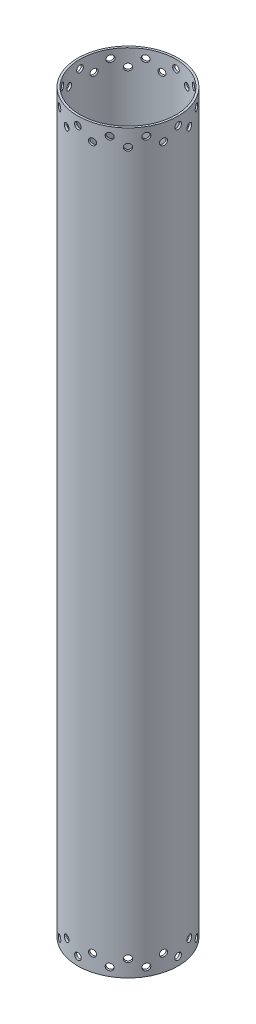
from build123d import *

# Parameters (mm, degrees)
SKETCH2_R                = 76.2
SKETCH2_R_2              = 73.025
BOSS_EXTRUDE1_DEPTH      = 1117.6
SKETCH3_R                = 5.0419
CUT_EXTRUDE1_DEPTH       = 1143
SKETCH6_R                = 5.0419
CUT_EXTRUDE2_DEPTH       = 25.4
CIRPATTERN2_COUNT        = 12
MIRROR1_COPY_1_SKETCH_R  = 5.0419
MIRROR1_COPY_1_DEPTH     = 1143
MIRROR1_COPY_2_SKETCH_R  = 5.0419
MIRROR1_COPY_2_DEPTH     = 1143
MIRROR1_COPY_3_SKETCH_R  = 5.0419
MIRROR1_COPY_3_DEPTH     = 1143
MIRROR1_COPY_4_SKETCH_R  = 5.0419
MIRROR1_COPY_4_DEPTH     = 1143
MIRROR1_COPY_5_SKETCH_R  = 5.0419
MIRROR1_COPY_5_DEPTH     = 1143
MIRROR1_COPY_6_SKETCH_R  = 5.0419
MIRROR1_COPY_6_DEPTH     = 1143
MIRROR1_COPY_7_SKETCH_R  = 5.0419
MIRROR1_COPY_7_DEPTH     = 1143
MIRROR1_COPY_8_SKETCH_R  = 5.0419
MIRROR1_COPY_8_DEPTH     = 1143
MIRROR1_COPY_9_SKETCH_R  = 5.0419
MIRROR1_COPY_9_DEPTH     = 1143
MIRROR1_COPY_10_SKETCH_R = 5.0419
MIRROR1_COPY_10_DEPTH    = 1143
MIRROR1_COPY_11_SKETCH_R = 5.0419
MIRROR1_COPY_11_DEPTH    = 1143
MIRROR1_COPY_12_SKETCH_R = 5.0419
MIRROR1_COPY_12_DEPTH    = 25.4
MIRROR1_COPY_13_SKETCH_R = 5.0419
MIRROR1_COPY_13_DEPTH    = 25.4
MIRROR1_COPY_14_SKETCH_R = 5.0419
MIRROR1_COPY_14_DEPTH    = 25.4
MIRROR1_COPY_15_SKETCH_R = 5.0419
MIRROR1_COPY_15_DEPTH    = 25.4
MIRROR1_COPY_16_SKETCH_R = 5.0419
MIRROR1_COPY_16_DEPTH    = 25.4
MIRROR1_COPY_17_SKETCH_R = 5.0419
MIRROR1_COPY_17_DEPTH    = 25.4
MIRROR1_COPY_18_SKETCH_R = 5.0419
MIRROR1_COPY_18_DEPTH    = 25.4
MIRROR1_COPY_19_SKETCH_R = 5.0419
MIRROR1_COPY_19_DEPTH    = 25.4
MIRROR1_COPY_20_SKETCH_R = 5.0419
MIRROR1_COPY_20_DEPTH    = 25.4
MIRROR1_COPY_21_SKETCH_R = 5.0419
MIRROR1_COPY_21_DEPTH    = 25.4
MIRROR1_COPY_22_SKETCH_R = 5.0419
MIRROR1_COPY_22_DEPTH    = 25.4
MIRROR1_COPY_23_SKETCH_R = 5.0419
MIRROR1_COPY_23_DEPTH    = 1143
MIRROR1_COPY_24_SKETCH_R = 5.0419
MIRROR1_COPY_24_DEPTH    = 25.4


with BuildPart() as part:
    # Sketch2 → Boss-Extrude1 (new body)
    with BuildSketch(Plane(origin=(0, 0, 0), x_dir=(1, 0, 0), z_dir=(0, 1, 0))):
        Circle(SKETCH2_R)
        Circle(SKETCH2_R_2, mode=Mode.SUBTRACT)
    extrude(amount=BOSS_EXTRUDE1_DEPTH)

    # Sketch3 → Cut-Extrude1 (cut)
    with BuildSketch(Plane.XY):
        with Locations((0, 1104.9)):
            Circle(SKETCH3_R)
    cut_extrude1 = extrude(amount=-CUT_EXTRUDE1_DEPTH, mode=Mode.SUBTRACT)

    # Sketch6 → Cut-Extrude2 (cut)
    with BuildSketch(Plane(origin=(-19.722011237, 0, 73.603547963), x_dir=(0, -1, 0), z_dir=(-0.25881904510252135, 0, 0.9659258262890681))):
        with Locations((-1092.2, 0)):
            Circle(SKETCH6_R)
    cut_extrude2 = extrude(amount=-CUT_EXTRUDE2_DEPTH, mode=Mode.SUBTRACT)

    # CirPattern2: Cut-Extrude1, Cut-Extrude2 ×12 about axis
    cirpattern2_axis = Axis((0, 1117.6, 0), (0, -1, 0))
    add([cut_extrude1.rotate(cirpattern2_axis, i * 360 / CIRPATTERN2_COUNT) for i in range(1, CIRPATTERN2_COUNT)], mode=Mode.SUBTRACT)
    add([cut_extrude2.rotate(cirpattern2_axis, i * 360 / CIRPATTERN2_COUNT) for i in range(1, CIRPATTERN2_COUNT)], mode=Mode.SUBTRACT)

    # Mirror1 copy 1 sketch → Mirror1 copy 1 (cut)
    with BuildSketch(Plane(origin=(0, 1117.6, 0), x_dir=(0.8660254037844387, 0, 0.49999999999999994), z_dir=(-0.49999999999999994, 0, 0.8660254037844387))):
        with Locations((0, -1104.9)):
            Circle(MIRROR1_COPY_1_SKETCH_R)
    extrude(amount=-MIRROR1_COPY_1_DEPTH, mode=Mode.SUBTRACT)

    # Mirror1 copy 2 sketch → Mirror1 copy 2 (cut)
    with BuildSketch(Plane(origin=(0, 1117.6, 0), x_dir=(0.5000000000000001, 0, 0.8660254037844386), z_dir=(-0.8660254037844386, 0, 0.5000000000000001))):
        with Locations((0, -1104.9)):
            Circle(MIRROR1_COPY_2_SKETCH_R)
    extrude(amount=-MIRROR1_COPY_2_DEPTH, mode=Mode.SUBTRACT)

    # Mirror1 copy 3 sketch → Mirror1 copy 3 (cut)
    with BuildSketch(Plane(origin=(0, 1117.6, 0), x_dir=(0, 0, 1), z_dir=(-1, 0, 0))):
        with Locations((0, -1104.9)):
            Circle(MIRROR1_COPY_3_SKETCH_R)
    extrude(amount=-MIRROR1_COPY_3_DEPTH, mode=Mode.SUBTRACT)

    # Mirror1 copy 4 sketch → Mirror1 copy 4 (cut)
    with BuildSketch(Plane(origin=(0, 1117.6, 0), x_dir=(-0.4999999999999998, 0, 0.8660254037844387), z_dir=(-0.8660254037844387, 0, -0.4999999999999998))):
        with Locations((0, -1104.9)):
            Circle(MIRROR1_COPY_4_SKETCH_R)
    extrude(amount=-MIRROR1_COPY_4_DEPTH, mode=Mode.SUBTRACT)

    # Mirror1 copy 5 sketch → Mirror1 copy 5 (cut)
    with BuildSketch(Plane(origin=(0, 1117.6, 0), x_dir=(-0.8660254037844387, 0, 0.49999999999999994), z_dir=(-0.49999999999999994, 0, -0.8660254037844387))):
        with Locations((0, -1104.9)):
            Circle(MIRROR1_COPY_5_SKETCH_R)
    extrude(amount=-MIRROR1_COPY_5_DEPTH, mode=Mode.SUBTRACT)

    # Mirror1 copy 6 sketch → Mirror1 copy 6 (cut)
    with BuildSketch(Plane(origin=(0, 1117.6, 0), x_dir=(-1, 0, 0), z_dir=(0, 0, -1))):
        with Locations((0, -1104.9)):
            Circle(MIRROR1_COPY_6_SKETCH_R)
    extrude(amount=-MIRROR1_COPY_6_DEPTH, mode=Mode.SUBTRACT)

    # Mirror1 copy 7 sketch → Mirror1 copy 7 (cut)
    with BuildSketch(Plane(origin=(0, 1117.6, 0), x_dir=(-0.8660254037844386, 0, -0.5000000000000001), z_dir=(0.5000000000000001, 0, -0.8660254037844386))):
        with Locations((0, -1104.9)):
            Circle(MIRROR1_COPY_7_SKETCH_R)
    extrude(amount=-MIRROR1_COPY_7_DEPTH, mode=Mode.SUBTRACT)

    # Mirror1 copy 8 sketch → Mirror1 copy 8 (cut)
    with BuildSketch(Plane(origin=(0, 1117.6, 0), x_dir=(-0.5000000000000004, 0, -0.8660254037844384), z_dir=(0.8660254037844384, 0, -0.5000000000000004))):
        with Locations((0, -1104.9)):
            Circle(MIRROR1_COPY_8_SKETCH_R)
    extrude(amount=-MIRROR1_COPY_8_DEPTH, mode=Mode.SUBTRACT)

    # Mirror1 copy 9 sketch → Mirror1 copy 9 (cut)
    with BuildSketch(Plane(origin=(0, 1117.6, 0), x_dir=(0, 0, -1), z_dir=(1, 0, 0))):
        with Locations((0, -1104.9)):
            Circle(MIRROR1_COPY_9_SKETCH_R)
    extrude(amount=-MIRROR1_COPY_9_DEPTH, mode=Mode.SUBTRACT)

    # Mirror1 copy 10 sketch → Mirror1 copy 10 (cut)
    with BuildSketch(Plane(origin=(0, 1117.6, 0), x_dir=(0.5000000000000001, 0, -0.8660254037844386), z_dir=(0.8660254037844386, 0, 0.5000000000000001))):
        with Locations((0, -1104.9)):
            Circle(MIRROR1_COPY_10_SKETCH_R)
    extrude(amount=-MIRROR1_COPY_10_DEPTH, mode=Mode.SUBTRACT)

    # Mirror1 copy 11 sketch → Mirror1 copy 11 (cut)
    with BuildSketch(Plane(origin=(0, 1117.6, 0), x_dir=(0.8660254037844384, 0, -0.5000000000000004), z_dir=(0.5000000000000004, 0, 0.8660254037844384))):
        with Locations((0, -1104.9)):
            Circle(MIRROR1_COPY_11_SKETCH_R)
    extrude(amount=-MIRROR1_COPY_11_DEPTH, mode=Mode.SUBTRACT)

    # Mirror1 copy 12 sketch → Mirror1 copy 12 (cut)
    with BuildSketch(Plane(origin=(-53.881536726, 1117.6, 53.881536726), x_dir=(0, 1, 0), z_dir=(-0.7071067811865479, 0, 0.7071067811865472))):
        with Locations((-1092.2, 0)):
            Circle(MIRROR1_COPY_12_SKETCH_R)
    extrude(amount=-MIRROR1_COPY_12_DEPTH, mode=Mode.SUBTRACT)

    # Mirror1 copy 13 sketch → Mirror1 copy 13 (cut)
    with BuildSketch(Plane(origin=(-73.603547963, 1117.6, 19.722011237), x_dir=(0, 1, 0), z_dir=(-0.9659258262890684, 0, 0.2588190451025203))):
        with Locations((-1092.2, 0)):
            Circle(MIRROR1_COPY_13_SKETCH_R)
    extrude(amount=-MIRROR1_COPY_13_DEPTH, mode=Mode.SUBTRACT)

    # Mirror1 copy 14 sketch → Mirror1 copy 14 (cut)
    with BuildSketch(Plane(origin=(-73.603547963, 1117.6, -19.722011237), x_dir=(0, 1, 0), z_dir=(-0.9659258262890681, 0, -0.2588190451025213))):
        with Locations((-1092.2, 0)):
            Circle(MIRROR1_COPY_14_SKETCH_R)
    extrude(amount=-MIRROR1_COPY_14_DEPTH, mode=Mode.SUBTRACT)

    # Mirror1 copy 15 sketch → Mirror1 copy 15 (cut)
    with BuildSketch(Plane(origin=(-53.881536726, 1117.6, -53.881536726), x_dir=(0, 1, 0), z_dir=(-0.7071067811865472, 0, -0.7071067811865477))):
        with Locations((-1092.2, 0)):
            Circle(MIRROR1_COPY_15_SKETCH_R)
    extrude(amount=-MIRROR1_COPY_15_DEPTH, mode=Mode.SUBTRACT)

    # Mirror1 copy 16 sketch → Mirror1 copy 16 (cut)
    with BuildSketch(Plane(origin=(-19.722011237, 1117.6, -73.603547963), x_dir=(0, 1, 0), z_dir=(-0.2588190451025201, 0, -0.9659258262890684))):
        with Locations((-1092.2, 0)):
            Circle(MIRROR1_COPY_16_SKETCH_R)
    extrude(amount=-MIRROR1_COPY_16_DEPTH, mode=Mode.SUBTRACT)

    # Mirror1 copy 17 sketch → Mirror1 copy 17 (cut)
    with BuildSketch(Plane(origin=(19.722011237, 1117.6, -73.603547963), x_dir=(0, 1, 0), z_dir=(0.25881904510252124, 0, -0.9659258262890681))):
        with Locations((-1092.2, 0)):
            Circle(MIRROR1_COPY_17_SKETCH_R)
    extrude(amount=-MIRROR1_COPY_17_DEPTH, mode=Mode.SUBTRACT)

    # Mirror1 copy 18 sketch → Mirror1 copy 18 (cut)
    with BuildSketch(Plane(origin=(53.881536726, 1117.6, -53.881536726), x_dir=(0, 1, 0), z_dir=(0.707106781186548, 0, -0.707106781186547))):
        with Locations((-1092.2, 0)):
            Circle(MIRROR1_COPY_18_SKETCH_R)
    extrude(amount=-MIRROR1_COPY_18_DEPTH, mode=Mode.SUBTRACT)

    # Mirror1 copy 19 sketch → Mirror1 copy 19 (cut)
    with BuildSketch(Plane(origin=(73.603547963, 1117.6, -19.722011237), x_dir=(0, 1, 0), z_dir=(0.9659258262890683, 0, -0.25881904510252063))):
        with Locations((-1092.2, 0)):
            Circle(MIRROR1_COPY_19_SKETCH_R)
    extrude(amount=-MIRROR1_COPY_19_DEPTH, mode=Mode.SUBTRACT)

    # Mirror1 copy 20 sketch → Mirror1 copy 20 (cut)
    with BuildSketch(Plane(origin=(73.603547963, 1117.6, 19.722011237), x_dir=(0, 1, 0), z_dir=(0.9659258262890681, 0, 0.2588190451025212))):
        with Locations((-1092.2, 0)):
            Circle(MIRROR1_COPY_20_SKETCH_R)
    extrude(amount=-MIRROR1_COPY_20_DEPTH, mode=Mode.SUBTRACT)

    # Mirror1 copy 21 sketch → Mirror1 copy 21 (cut)
    with BuildSketch(Plane(origin=(53.881536726, 1117.6, 53.881536726), x_dir=(0, 1, 0), z_dir=(0.707106781186547, 0, 0.707106781186548))):
        with Locations((-1092.2, 0)):
            Circle(MIRROR1_COPY_21_SKETCH_R)
    extrude(amount=-MIRROR1_COPY_21_DEPTH, mode=Mode.SUBTRACT)

    # Mirror1 copy 22 sketch → Mirror1 copy 22 (cut)
    with BuildSketch(Plane(origin=(19.722011237, 1117.6, 73.603547963), x_dir=(0, 1, 0), z_dir=(0.25881904510252063, 0, 0.9659258262890683))):
        with Locations((-1092.2, 0)):
            Circle(MIRROR1_COPY_22_SKETCH_R)
    extrude(amount=-MIRROR1_COPY_22_DEPTH, mode=Mode.SUBTRACT)

    # Mirror1 copy 23 sketch → Mirror1 copy 23 (cut)
    with BuildSketch(Plane(origin=(0, 1117.6, 0), x_dir=(1, 0, 0), z_dir=(0, 0, 1))):
        with Locations((0, -1104.9)):
            Circle(MIRROR1_COPY_23_SKETCH_R)
    extrude(amount=-MIRROR1_COPY_23_DEPTH, mode=Mode.SUBTRACT)

    # Mirror1 copy 24 sketch → Mirror1 copy 24 (cut)
    with BuildSketch(Plane(origin=(-19.722011237, 1117.6, 73.603547963), x_dir=(0, 1, 0), z_dir=(-0.25881904510252135, 0, 0.9659258262890681))):
        with Locations((-1092.2, 0)):
            Circle(MIRROR1_COPY_24_SKETCH_R)
    extrude(amount=-MIRROR1_COPY_24_DEPTH, mode=Mode.SUBTRACT)


solid = part.part
